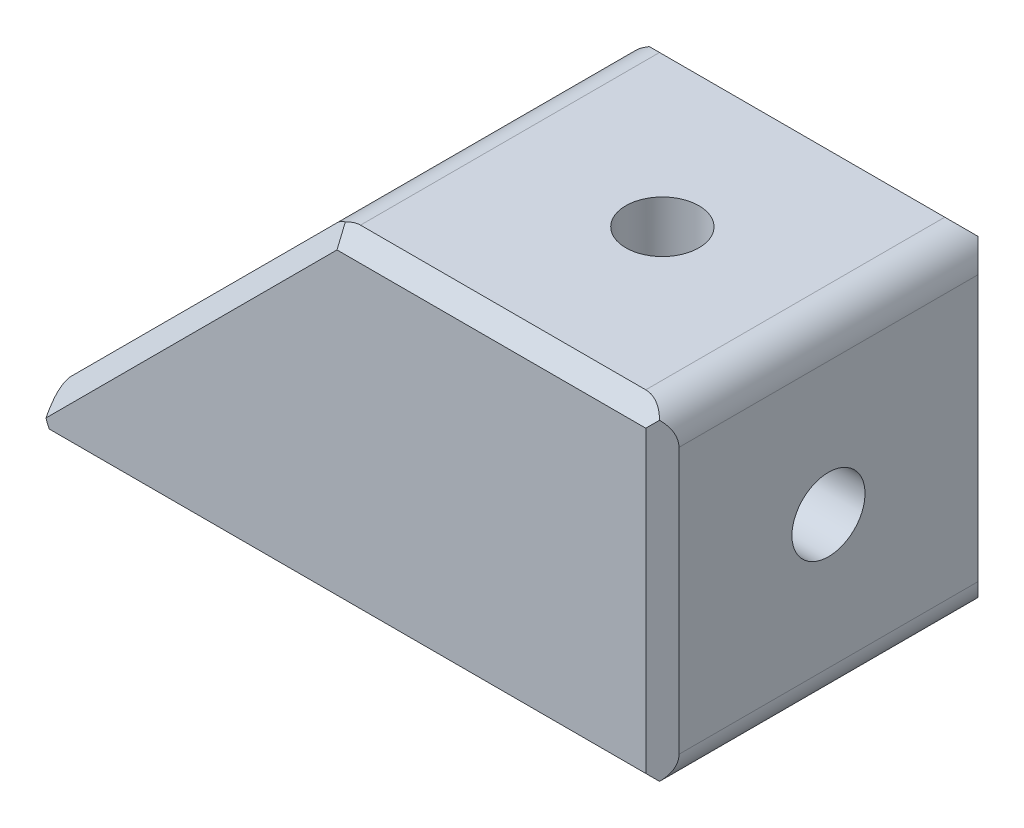
from build123d import *

# Parameters (mm, degrees)
SKETCH1_W                  = 40
SKETCH1_H                  = 20
BOSS_EXTRUDE1_DEPTH        = 20
F_4_4_4_4_DIAMETER_HOLE1_D = 4.4
F_4_4_4_4_DIAMETER_HOLE2_D = 4.4
F_4_4_4_4_DIAMETER_HOLE3_D = 4.4
CUT_EXTRUDE2_DEPTH         = 49.989794856
CHAMFER3_SIZE              = 1
FILLET2_R                  = 2


with BuildPart() as part:
    # Sketch1 → Boss-Extrude1 (new body)
    with BuildSketch(Plane.XY):
        with Locations((20, 10)):
            Rectangle(SKETCH1_W, SKETCH1_H)
    extrude(amount=BOSS_EXTRUDE1_DEPTH)

    # Ø4.4 (4.4) Diameter Hole1 (through all)
    with Locations(Plane.ZY):
        with Locations((10, 10)):
            Hole(F_4_4_4_4_DIAMETER_HOLE1_D / 2)

    # Ø4.4 (4.4) Diameter Hole2 (through all)
    with Locations(Plane(origin=(0, 0, 0), x_dir=(-1, 0, 0), z_dir=(0, -1, 0))):
        with Locations((-30, -10)):
            Hole(F_4_4_4_4_DIAMETER_HOLE2_D / 2)

    # Ø4.4 (4.4) Diameter Hole3 (through all)
    with Locations(Plane(origin=(0, 0, 0), x_dir=(-1, 0, 0), z_dir=(0, -1, 0))):
        with Locations((-10, -10)):
            Hole(F_4_4_4_4_DIAMETER_HOLE3_D / 2)

    # Sketch9 → Cut-Extrude2 (cut, through all)
    with BuildSketch(Plane(origin=(0, 0, 0), x_dir=(-1, 0, 0), z_dir=(0, 0, -1))):
        Polygon((0, 0), (-20, 20), (0, 20), align=None)
    extrude(amount=-CUT_EXTRUDE2_DEPTH, mode=Mode.SUBTRACT)

    # Chamfer3
    chamfer3_edges = [part.edges().sort_by_distance(p)[0] for p in [
        (40, 10, 20),
        (30, 20, 20),
        (10, 10, 20),
        (10, 10, 0),
        (30, 20, 0),
        (40, 10, 0),
        (20, 0, 0),
        (20, 0, 20),
    ]]
    chamfer(chamfer3_edges, length=CHAMFER3_SIZE)

    # Fillet2
    # the kernel refuses this fillet: 2 mm, written as the material it takes off along each edge
    with BuildSketch(Plane(origin=(0, 0, -11.071067812), x_dir=(1, 0, 0), z_dir=(0, 0, 1))) as fillet2_piece_1:
        with BuildLine():
            CenterArc((FILLET2_R * 2.41421356237, FILLET2_R), FILLET2_R, 135, 135)
            Line((FILLET2_R * 1.70710678119, FILLET2_R * 1.70710678119), (0, 0))
            Line((0, 0), (FILLET2_R * 2.41421356237, 0))
        make_face()
    extrude(amount=42.142135624, mode=Mode.SUBTRACT)
    with BuildSketch(Plane(origin=(20, 20, -1.071067812), x_dir=(-0.7071067811865476, -0.7071067811865476, 0), z_dir=(0, 0, 1))) as fillet2_piece_2:
        with BuildLine():
            CenterArc((FILLET2_R * 0.414213562373, FILLET2_R), FILLET2_R, 225, 45)
            Line((-FILLET2_R * 0.292893218813, FILLET2_R * 0.292893218813), (0, 0))
            Line((0, 0), (FILLET2_R * 0.414213562373, 0))
        make_face()
    extrude(amount=22.142135624, mode=Mode.SUBTRACT)
    with BuildSketch(Plane(origin=(40, 20, -4), x_dir=(0, -1, 0), z_dir=(0, 0, 1)), Plane(origin=(40, 0, -4), x_dir=(-1, 0, 0), z_dir=(0, 0, 1))) as fillet2_piece_3:
        with BuildLine():
            CenterArc((FILLET2_R, -FILLET2_R), FILLET2_R, 90, 90)
            Line((0, -FILLET2_R), (0, 0))
            Line((0, 0), (FILLET2_R, 0))
        make_face()
    extrude(amount=28, mode=Mode.SUBTRACT)


solid = part.part
